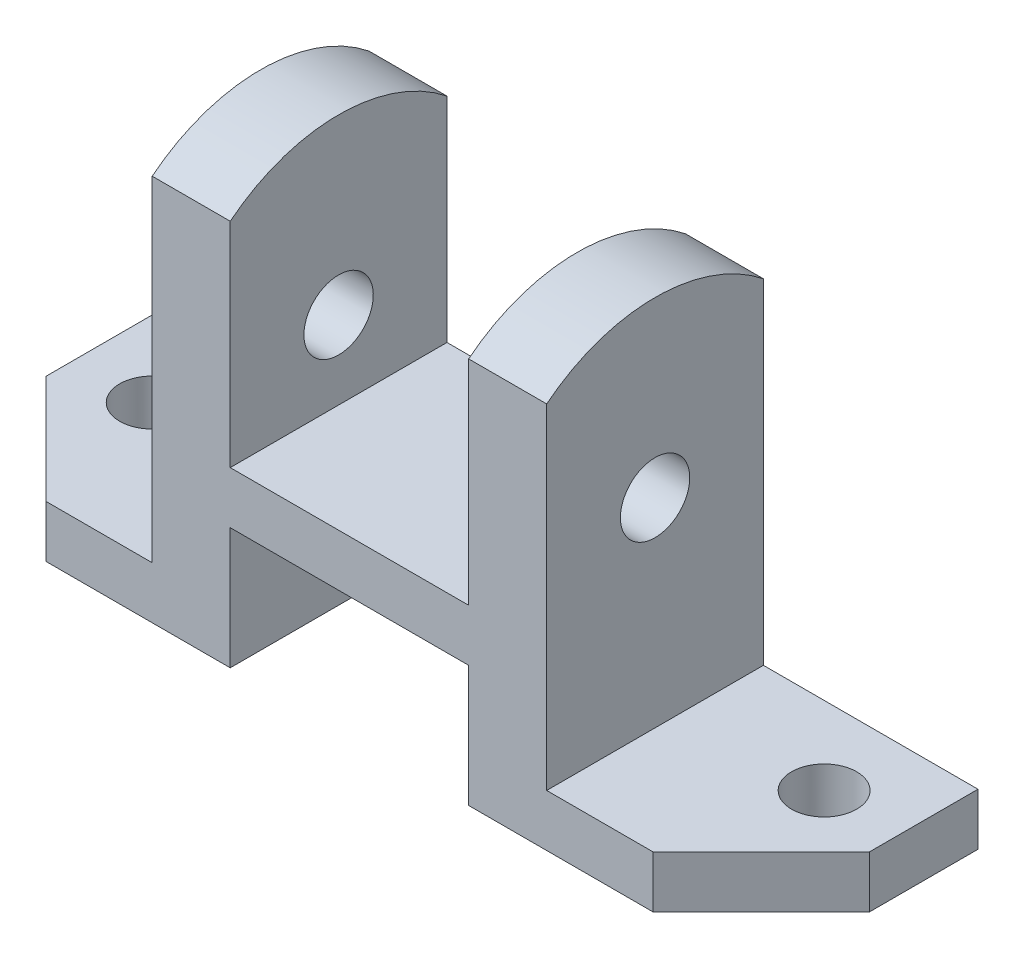
from build123d import *

# Parameters (mm, degrees)
BOSS_EXTRUDE1_DEPTH = 25
RIB1_START          = -28
RIB1_OUTLINE_W      = 55
RIB1_OUTLINE_H      = 8
RIB1_DEPTH          = 28
CUT_EXTRUDE1_DEPTH  = 100
SKETCH2_5_R         = 7.5
CUT_EXTRUDE2_DEPTH  = 20
CHAMFER2_SIZE       = 25


# Read off the part's stored shape, not the designer's step: Rib1
with BuildPart() as part:
    # Sketch1 → Boss-Extrude1 (new, symmetric)
    with BuildSketch(Plane.XY):
        Polygon((27.5, 0), (0, 0), (0, -12), (27.5, -12), (27.5, -40), (95, -40), (95, -28), (45.5, -28), (45.5, 58), (27.5, 58), align=None)
        Polygon((0, -12), (0, 0), (-27.5, 0), (-27.5, 58), (-45.5, 58), (-45.5, -28), (-95, -28), (-95, -40), (-27.5, -40), (-27.5, -12), align=None)
    extrude(amount=BOSS_EXTRUDE1_DEPTH, both=True)

    # Rib1 outline → Rib1 (add)
    with BuildSketch(Plane.XZ.offset(40).offset(RIB1_START)):
        with Locations((0, -7)):
            Rectangle(RIB1_OUTLINE_W, RIB1_OUTLINE_H)
    extrude(amount=RIB1_DEPTH)

    # Sketch4 → Cut-Extrude1 (cut)
    with BuildSketch(Plane.ZY.offset(45.5)):
        with BuildLine():
            ThreePointArc((8, 18), (5.656854249, 23.656854249), (0, 26))
            Line((0, 26), (0, 10))
            ThreePointArc((0, 10), (5.656854249, 12.343145751), (8, 18))
        make_face()
        with BuildLine():
            Line((0, 10), (0, 26))
            ThreePointArc((0, 26), (-8, 18), (0, 10))
        make_face()
        with BuildLine():
            Line((25, 49.224989992), (25, 58))
            Line((25, 58), (-1.3e-08, 58))
            ThreePointArc((-1.3e-08, 58), (13.247648848, 55.742546284), (25, 49.224989992))
        make_face()
        with BuildLine():
            ThreePointArc((-25, 49.224989992), (-13.24764886, 55.74254628), (-1.3e-08, 58))
            Line((-1.3e-08, 58), (-25, 58))
            Line((-25, 58), (-25, 49.224989992))
        make_face()
    extrude(amount=-CUT_EXTRUDE1_DEPTH, mode=Mode.SUBTRACT)

    # Sketch2<5> → Cut-Extrude2 (cut)
    with BuildSketch(Plane.XZ.offset(40)):
        with Locations(Location((-77.5, -7, 0), (0, 0, 270))):
            Circle(SKETCH2_5_R)
        with Locations(Location((77.5, -7, 0), (0, 0, 270))):
            Circle(SKETCH2_5_R)
    extrude(amount=-CUT_EXTRUDE2_DEPTH, mode=Mode.SUBTRACT)

    # Chamfer2
    chamfer2_edges = [part.edges().sort_by_distance(p)[0] for p in [
        (-95, -34, 25),
        (95, -34, 25),
    ]]
    chamfer(chamfer2_edges, length=CHAMFER2_SIZE)


solid = part.part
